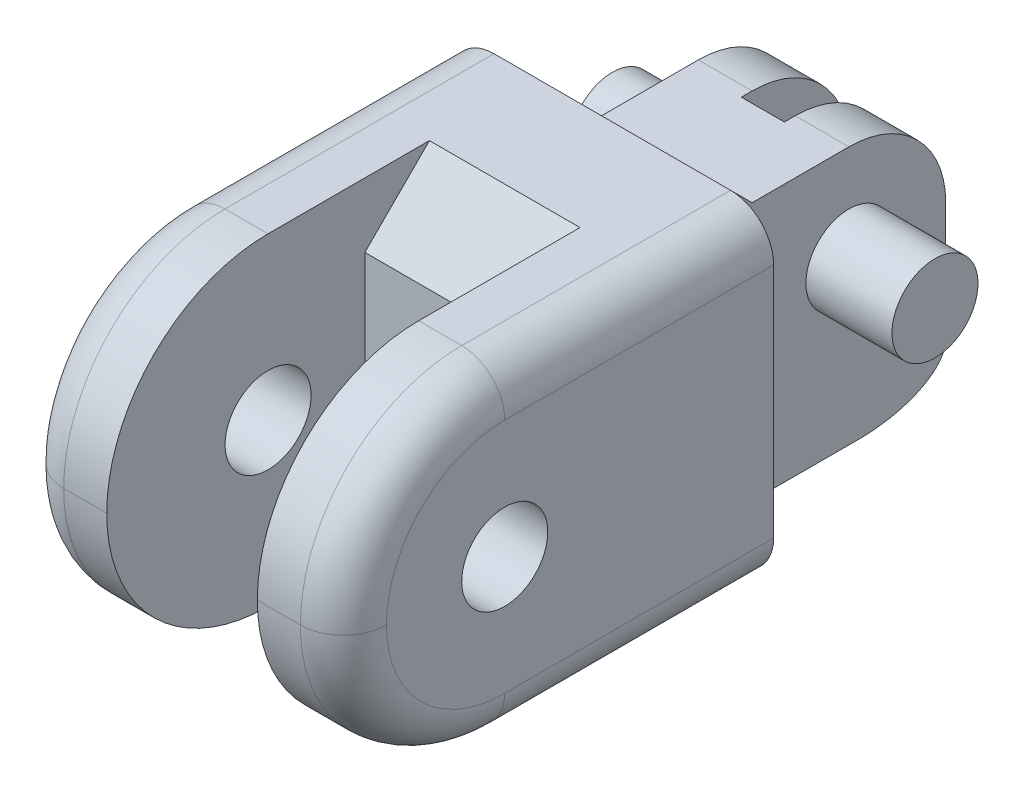
from build123d import *

# Parameters (mm, degrees)
SKETCH1_W                = 15
SKETCH1_H                = 15
BOSS_EXTRUDE1_DEPTH      = 35
SKETCH3_W                = 7
SKETCH3_H                = 15
CUT_EXTRUDE1_DEPTH       = 12
SKETCH4_R                = 2
CUT_EXTRUDE2_DEPTH       = 15
SKETCH5_W                = 4
SKETCH5_H                = 15
CUT_EXTRUDE3_DEPTH       = 15
BOSS_EXTRUDE2_DEPTH      = 7.5
BOSS_EXTRUDE2_DEPTH_BACK = 7.5
SKETCH6_R                = 2
FILLET1_R                = 7.5
CUT_EXTRUDE6_DEPTH       = 3.5
CUT_EXTRUDE6_DEPTH_BACK  = 3.5
FILLET2_R                = 2
CUT_EXTRUDE7_DEPTH       = 7.5
CUT_EXTRUDE7_DEPTH_BACK  = 7.5
FILLET3_SIZE             = 4
FILLET3_SIZE_2           = 2
CUT_EXTRUDE8_DEPTH       = 1
CUT_EXTRUDE8_DEPTH_BACK  = 1


# Some blends are built 0.0001 mm under size
with BuildPart() as part:
    # Sketch1 → Boss-Extrude1 (new body)
    with BuildSketch(Plane.XY):
        Rectangle(SKETCH1_W, SKETCH1_H)
    extrude(amount=BOSS_EXTRUDE1_DEPTH)

    # Sketch3 → Cut-Extrude1 (cut)
    with BuildSketch(Plane.XY.offset(35)):
        Rectangle(SKETCH3_W, SKETCH3_H)
    extrude(amount=-CUT_EXTRUDE1_DEPTH, mode=Mode.SUBTRACT)

    # Sketch4 → Cut-Extrude2 (cut)
    with BuildSketch(Plane(origin=(7.5, 0, 0), x_dir=(0, 0, -1), z_dir=(1, 0, 0))):
        with Locations(Location((-27.5, 0, 0), (0, 0, 90))):
            Circle(SKETCH4_R)
    extrude(amount=-CUT_EXTRUDE2_DEPTH, mode=Mode.SUBTRACT)

    # Sketch5 → Cut-Extrude3 (cut)
    with BuildSketch(Plane(origin=(0, 0, 0), x_dir=(-1, 0, 0), z_dir=(0, 0, -1))):
        with Locations((-5.5, 0)):
            Rectangle(SKETCH5_W, SKETCH5_H)
        with Locations((5.5, 0)):
            Rectangle(SKETCH5_W, SKETCH5_H)
    extrude(amount=-CUT_EXTRUDE3_DEPTH, mode=Mode.SUBTRACT)

    # Sketch6 → Boss-Extrude2 (add, two sides: drawn at the far end of the back side and taken through both)
    with BuildSketch(Plane(origin=(0, 0, 0), x_dir=(0, 0, -1), z_dir=(1, 0, 0)).offset(-BOSS_EXTRUDE2_DEPTH_BACK)):
        with Locations((-7.5, 0)):
            Circle(SKETCH6_R)
    extrude(amount=BOSS_EXTRUDE2_DEPTH + BOSS_EXTRUDE2_DEPTH_BACK)

    # Fillet1
    fillet1_edges = [part.edges().sort_by_distance(p)[0] for p in [
        (5.5, -7.5, 35),
        (-5.5, -7.5, 35),
        (-5.5, 7.5, 35),
        (5.5, 7.5, 35),
    ]]
    fillet(fillet1_edges, radius=FILLET1_R - 0.0001)  # a hair under: the kernel refuses the full size

    # Sketch7 → Cut-Extrude6 (cut, two sides: drawn at the far end of the back side and taken through both)
    with BuildSketch(Plane(origin=(0, 0, 0), x_dir=(0, 0, -1), z_dir=(1, 0, 0)).offset(-CUT_EXTRUDE6_DEPTH_BACK)):
        Polygon((-23, 7.5), (-23, 4.5), (-20, 7.5), align=None)
    extrude(amount=CUT_EXTRUDE6_DEPTH + CUT_EXTRUDE6_DEPTH_BACK, mode=Mode.SUBTRACT)

    # Fillet2
    fillet2_edges = [part.edges().sort_by_distance(p)[0] for p in [
        (7.5, -7.5, 21.25005),
        (7.5, 7.5, 21.25005),
        (7.5, 5.303330148, 32.803330148),
        (7.5, -5.303330148, 32.803330148),
        (-7.5, -7.5, 21.25005),
        (-7.5, 7.5, 21.25005),
        (-7.5, 5.303330148, 32.803330148),
        (-7.5, -5.303330148, 32.803330148),
    ]]
    fillet(fillet2_edges, radius=FILLET2_R)

    # Sketch8 → Cut-Extrude7 (cut, two sides: drawn at the far end of the back side and taken through both)
    with BuildSketch(Plane(origin=(0, 0, 0), x_dir=(0, 0, -1), z_dir=(1, 0, 0)).offset(-CUT_EXTRUDE7_DEPTH_BACK)):
        with BuildLine():
            Line((-15, 7.5), (-12, 4.5))
            Line((-12, 4.5), (-7.5, 4.5))
            ThreePointArc((-7.5, 4.5), (-4.318019485, 3.181980515), (-3, 0))
            Line((-3, 0), (-3, -7.5))
            Line((-3, -7.5), (0, -7.5))
            Line((0, -7.5), (0, 7.5))
            Line((0, 7.5), (-15, 7.5))
        make_face()
    extrude(amount=CUT_EXTRUDE7_DEPTH + CUT_EXTRUDE7_DEPTH_BACK, mode=Mode.SUBTRACT)

    # Fillet3
    # an asymmetric fillet: 4, 2 mm, written as the material it takes off along each edge
    with BuildSketch(Plane(origin=(-13.5, -7.5, 3), x_dir=(0, 0, 1), z_dir=(1, 0, 0))) as fillet3_piece_1:
        with BuildLine():
            Bezier((FILLET3_SIZE, 0), (0, 0), (0, -FILLET3_SIZE_2), weights=[1, 0.707106781, 1])
            Line((0, -FILLET3_SIZE_2), (0, 0))
            Line((0, 0), (FILLET3_SIZE, 0))
        make_face()
    extrude(amount=27, mode=Mode.SUBTRACT)

    # Sketch9 → Cut-Extrude8 (cut, two sides: drawn at the far end of the back side and taken through both)
    with BuildSketch(Plane(origin=(0, 0, 0), x_dir=(0, 0, -1), z_dir=(1, 0, 0)).offset(-CUT_EXTRUDE8_DEPTH_BACK)):
        with BuildLine():
            Line((-8, -0.5), (-8, 9.147620524))
            ThreePointArc((-8, 9.147620524), (-1.178102105, 6.321897895), (1.647620524, -0.5))
            Line((1.647620524, -0.5), (-8, -0.5))
        make_face()
    extrude(amount=CUT_EXTRUDE8_DEPTH + CUT_EXTRUDE8_DEPTH_BACK, mode=Mode.SUBTRACT)


solid = part.part
